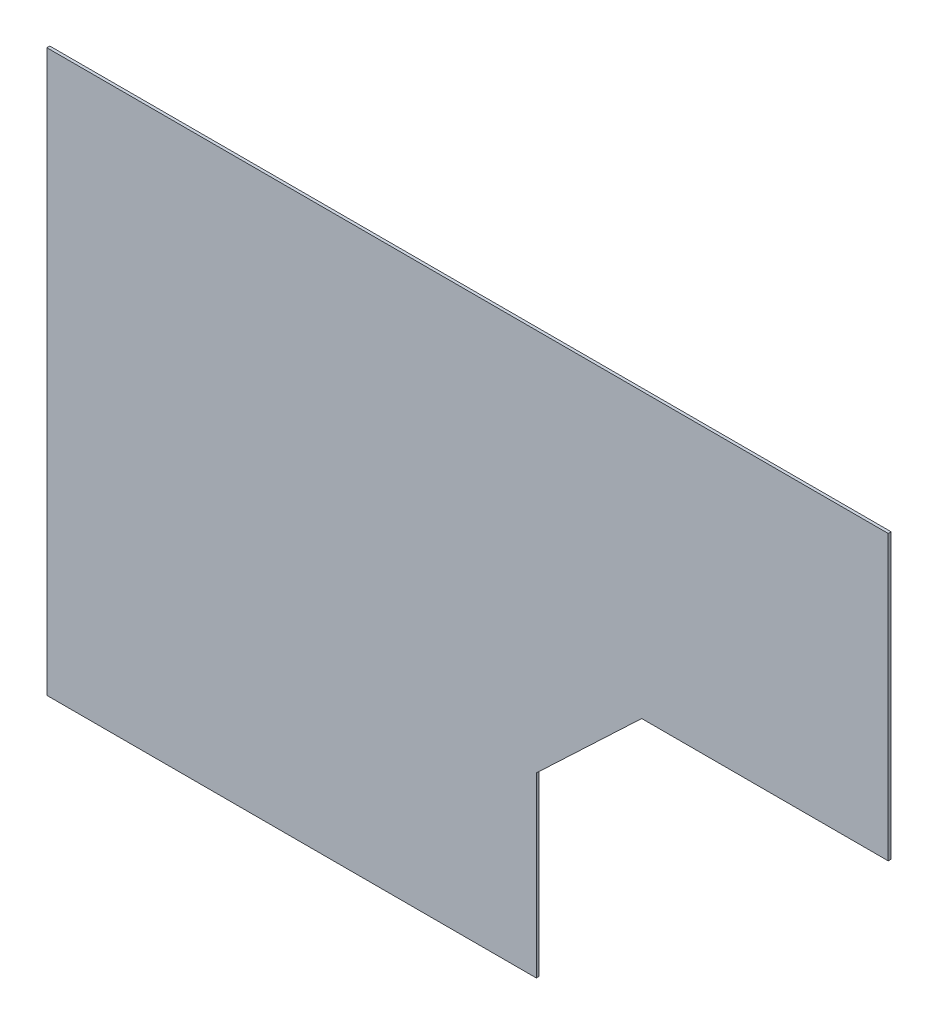
from build123d import *

# Parameters (mm, degrees)
SKETCH1_W           = 914.4
SKETCH1_H           = 609.6
BOSS_EXTRUDE1_DEPTH = 3.175
CUT_EXTRUDE1_DEPTH  = 1099.97661514


with BuildPart() as part:
    # Sketch1 → Boss-Extrude1 (new body)
    with BuildSketch(Plane.XY):
        with Locations((457.2, 304.8)):
            Rectangle(SKETCH1_W, SKETCH1_H)
    extrude(amount=BOSS_EXTRUDE1_DEPTH)

    # Sketch2 → Cut-Extrude1 (cut, through all)
    with BuildSketch(Plane.XY.offset(3.175)):
        Polygon((531.956644177, 0), (531.956644177, 193.001775375), (646.448801926, 301.432583596), (914.4, 301.432583596), (914.4, 0), align=None)
    extrude(amount=-CUT_EXTRUDE1_DEPTH, mode=Mode.SUBTRACT)


solid = part.part
